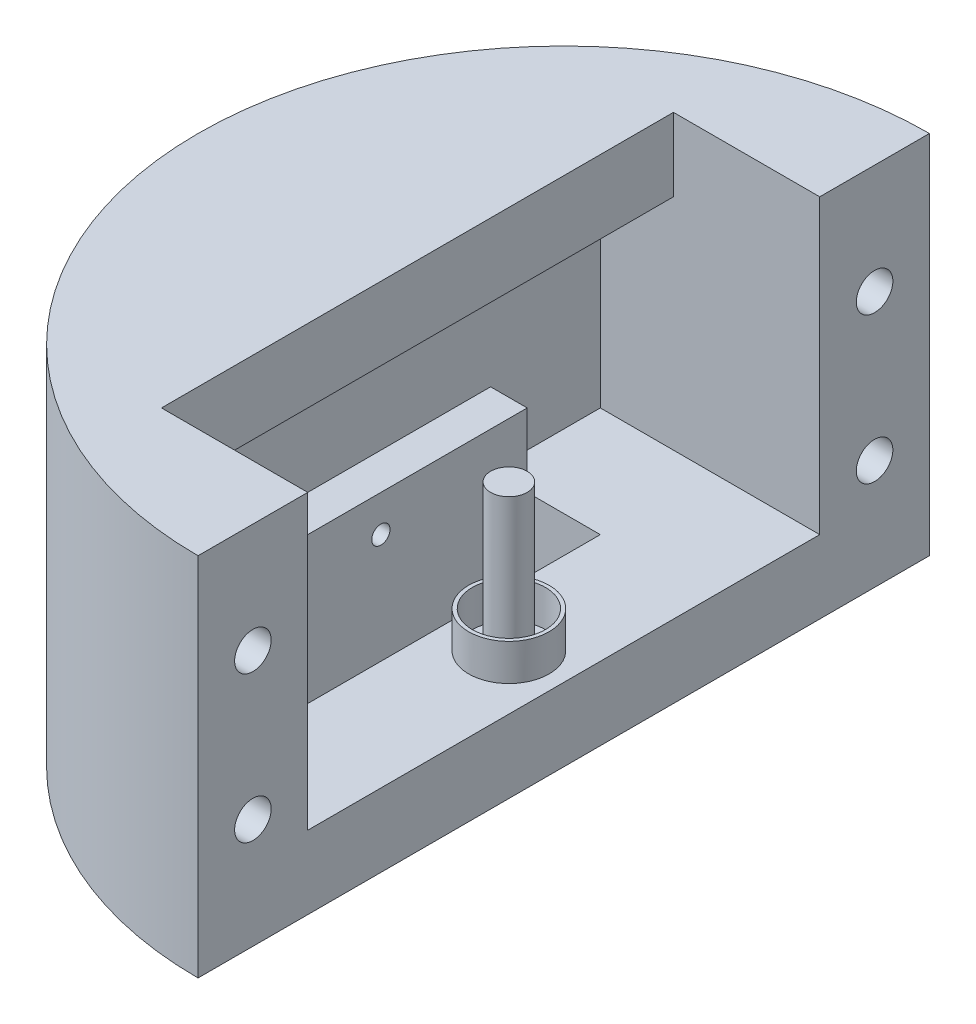
from build123d import *

# Parameters (mm, degrees)
SZKIC1_W                    = 5
SZKIC1_H                    = 10
DODANIE_WYCI_GNI_CIE1_DEPTH = 1
DODANIE_WYCI_GNI_CIE4_DEPTH = 4
ZAOKR_GLENIE2_R             = 5
SZKIC3_W                    = 1
SZKIC3_H                    = 4
WYTNIJ_WYCI_GNI_CIE1_DEPTH  = 4
SZKIC4_W                    = 0.5
SZKIC4_H                    = 4
DODANIE_WYCI_GNI_CIE5_DEPTH = 1
SZKIC5_R                    = 0.25
DODANIE_WYCI_GNI_CIE6_DEPTH = 2
SZKIC6_R                    = 0.55
SZKIC6_R_2                  = 0.5
DODANIE_WYCI_GNI_CIE7_DEPTH = 0.5
SZKIC7_W                    = 7
SZKIC7_H                    = 1
DODANIE_WYCI_GNI_CIE8_DEPTH = 1
SZKIC11_R                   = 0.25
WYTNIJ_WYCI_GNI_CIE2_DEPTH  = 0.5
SZKIC14_R                   = 0.125
WYTNIJ_WYCI_GNI_CIE3_DEPTH  = 1


with BuildPart() as part:
    # Szkic1 → Dodanie-wyciągnięcie1 (new body)
    with BuildSketch(Plane(origin=(0, 0, 0), x_dir=(1, 0, 0), z_dir=(0, 1, 0))):
        Rectangle(SZKIC1_W, SZKIC1_H)
    extrude(amount=DODANIE_WYCI_GNI_CIE1_DEPTH)

    # Szkic2 → Dodanie-wyciągnięcie4 (add)
    with BuildSketch(Plane(origin=(0, 1, 0), x_dir=(1, 0, 0), z_dir=(0, 1, 0))):
        Polygon((-2.5, 5), (2.5, 5), (2.5, 3.5), (-0.5, 3.5), (-0.5, -3.5), (2.5, -3.5), (2.5, -5), (-2.5, -5), align=None)
    extrude(amount=DODANIE_WYCI_GNI_CIE4_DEPTH)

    # Zaokrąglenie2
    zaokr_glenie2_edges = [part.edges().sort_by_distance(p)[0] for p in [
        (-2.5, 2.5, -5),
        (-2.5, 2.5, 5),
    ]]
    fillet(zaokr_glenie2_edges, radius=ZAOKR_GLENIE2_R - 0.0001)  # a hair under: the kernel refuses the full size

    # Szkic3 → Wytnij-wyciągnięcie1 (cut)
    with BuildSketch(Plane(origin=(0, 1, 0), x_dir=(1, 0, 0), z_dir=(0, 1, 0))):
        with Locations((0.5, 0)):
            Rectangle(SZKIC3_W, SZKIC3_H)
    extrude(amount=-WYTNIJ_WYCI_GNI_CIE1_DEPTH, mode=Mode.SUBTRACT)

    # Szkic4 → Dodanie-wyciągnięcie5 (add)
    with BuildSketch(Plane(origin=(0, 1, 0), x_dir=(1, 0, 0), z_dir=(0, 1, 0))):
        with Locations((-0.25, 0)):
            Rectangle(SZKIC4_W, SZKIC4_H)
    extrude(amount=DODANIE_WYCI_GNI_CIE5_DEPTH)

    # Szkic5 → Dodanie-wyciągnięcie6 (add)
    with BuildSketch(Plane(origin=(0, 1, 0), x_dir=(1, 0, 0), z_dir=(0, 1, 0))):
        with Locations(Location((1.75, 0, 0), (0, 0, 90))):
            Circle(SZKIC5_R)
    extrude(amount=DODANIE_WYCI_GNI_CIE6_DEPTH)

    # Szkic6 → Dodanie-wyciągnięcie7 (add)
    with BuildSketch(Plane(origin=(0, 1, 0), x_dir=(1, 0, 0), z_dir=(0, 1, 0))):
        with Locations(Location((1.75, 0, 0), (0, 0, 90))):
            Circle(SZKIC6_R)
        with Locations(Location((1.75, 0, 0), (0, 0, 270))):
            Circle(SZKIC6_R_2, mode=Mode.SUBTRACT)
    extrude(amount=DODANIE_WYCI_GNI_CIE7_DEPTH)

    # Szkic7 → Dodanie-wyciągnięcie8 (add)
    with BuildSketch(Plane(origin=(-0.5, 0, 0), x_dir=(0, 0, -1), z_dir=(1, 0, 0))):
        with Locations((0, 4.5)):
            Rectangle(SZKIC7_W, SZKIC7_H)
    extrude(amount=DODANIE_WYCI_GNI_CIE8_DEPTH)

    # Szkic11 → Wytnij-wyciągnięcie2 (cut)
    with BuildSketch(Plane(origin=(2.5, 0, 0), x_dir=(0, 0, -1), z_dir=(1, 0, 0))):
        with Locations((4.25, 3.503110499)):
            Circle(SZKIC11_R)
        with Locations((4.25, 1.503110499)):
            Circle(SZKIC11_R)
        with Locations((-4.25, 3.503110499)):
            Circle(SZKIC11_R)
        with Locations((-4.25, 1.503110499)):
            Circle(SZKIC11_R)
    extrude(amount=-WYTNIJ_WYCI_GNI_CIE2_DEPTH, mode=Mode.SUBTRACT)

    # Szkic14 → Wytnij-wyciągnięcie3 (cut)
    with BuildSketch(Plane(origin=(0, 0, 0), x_dir=(0, 0, -1), z_dir=(1, 0, 0))):
        with Locations((0, 1.5)):
            Circle(SZKIC14_R)
    extrude(amount=-WYTNIJ_WYCI_GNI_CIE3_DEPTH, mode=Mode.SUBTRACT)


solid = part.part
